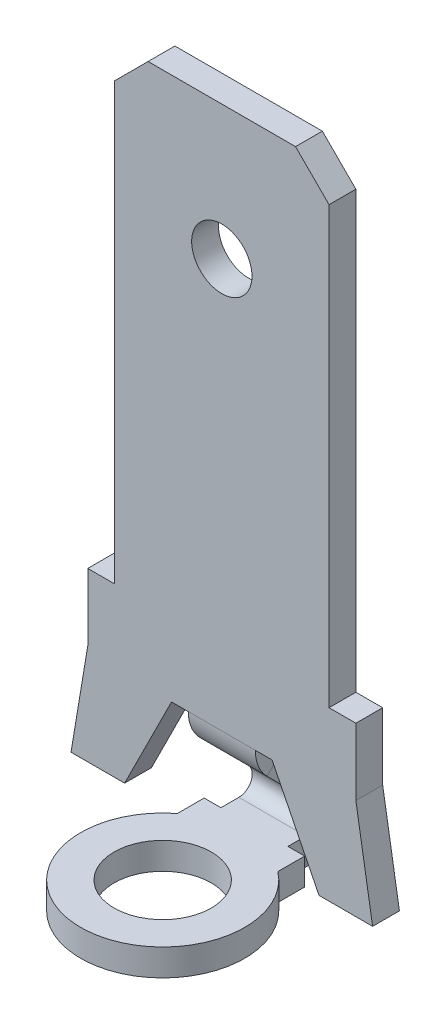
from build123d import *

# Parameters (mm, degrees)
MAINBODYS_W                           = 6.4
MAINBODYS_H                           = 0.8
MAIN_BODY_DEPTH                       = 14
BOTTOM_OF_MAIN_BODY_REACH             = 16.367
BOTTOM_OF_MAIN_BODY_DIRECTION_2_REACH = 16.367
TOPHOLES_R                            = 0.9
TOP_HOLE_DEPTH                        = 15.727185746
F_45_DEGREE_FLANGE_DEPTH              = 2
BOTTOM_FLAT_FLANGE_DEPTH              = 2
EXTENDEDBOTTOMFLANGES_W               = 3
EXTENDEDBOTTOMFLANGES_H               = 0.8
EXTENDED_BOTTOM_FLANGE_DEPTH          = 0.8
BOSSEDCYLINDERBODYS_R                 = 1.45
BOSSED_CYLINDER_BODY_DEPTH            = 0.8
C_MAIN_BODY_SIZE                      = 1


# Sheet-metal steps are written as plain solids
with BuildPart() as part:
    # MainBodyS → MAIN BODY (new body)
    with BuildSketch(Plane(origin=(0, 0, 0), x_dir=(1, 0, 0), z_dir=(0, 1, 0))):
        Rectangle(MAINBODYS_W, MAINBODYS_H)
    extrude(amount=MAIN_BODY_DEPTH)

    # BOTTOM OF MAIN BODY: up to this face of the body (flat: up to its plane)
    bottom_of_main_body_end = Plane(part.part.faces().sort_by_distance((0, 7, 0.4))[0])
    # BottomMainBodyS → BOTTOM OF MAIN BODY (add, up to the picked face)
    with BuildSketch(Plane.XY, mode=Mode.PRIVATE) as bottom_of_main_body_sk1:
        Polygon((0, 0), (4, 0), (4, -2), (4.5, -5), (2.9, -5), (1.5, -2.2), (0, -2.2), align=None)
    bottom_of_main_body_tool1 = split(extrude(bottom_of_main_body_sk1.sketch, amount=BOTTOM_OF_MAIN_BODY_REACH, mode=Mode.PRIVATE), bisect_by=bottom_of_main_body_end, keep=Keep.BOTH, mode=Mode.PRIVATE)
    bottom_of_main_body = bottom_of_main_body_tool1.solids().sort_by(Axis((2.475691, -2.049989, 0), (0, 0, 1)))[0]
    add(bottom_of_main_body)

    # BOTTOM OF MAIN BODY direction 2: up to this face of the body (flat: up to its plane)
    bottom_of_main_body_direction_2_end = Plane(part.part.faces().sort_by_distance((0, 7, -0.4))[0])
    # BottomMainBodyS → BOTTOM OF MAIN BODY direction 2 (add, up to the picked face)
    with BuildSketch(Plane.XY, mode=Mode.PRIVATE) as bottom_of_main_body_direction_2_sk1:
        Polygon((0, 0), (4, 0), (4, -2), (4.5, -5), (2.9, -5), (1.5, -2.2), (0, -2.2), align=None)
    bottom_of_main_body_direction_2_tool1 = split(extrude(bottom_of_main_body_direction_2_sk1.sketch, amount=-BOTTOM_OF_MAIN_BODY_DIRECTION_2_REACH, mode=Mode.PRIVATE), bisect_by=bottom_of_main_body_direction_2_end, keep=Keep.BOTH, mode=Mode.PRIVATE)
    bottom_of_main_body_direction_2 = bottom_of_main_body_direction_2_tool1.solids().sort_by(Axis((2.475691, -2.049989, 0), (0, 0, -1)))[0]
    add(bottom_of_main_body_direction_2)

    # BMB HM: BOTTOM OF MAIN BODY, BOTTOM OF MAIN BODY direction 2 across plane
    add(bottom_of_main_body.mirror(Plane(origin=(0, 0, 0), x_dir=(0, 0, 1), z_dir=(1, 0, 0))))
    add(bottom_of_main_body_direction_2.mirror(Plane(origin=(0, 0, 0), x_dir=(0, 0, 1), z_dir=(1, 0, 0))))

    # TopHoleS → TOP HOLE (cut, through all)
    with BuildSketch(Plane.XY.offset(0.4)):
        with Locations((0, 10)):
            Circle(TOPHOLES_R)
    extrude(amount=-TOP_HOLE_DEPTH, mode=Mode.SUBTRACT)

    # 45 DEGREE FLANGE section (across the edge) → 45 DEGREE FLANGE (add)
    with BuildSketch(Plane(origin=(1, -2.365685425, -0.4), x_dir=(0, 0.7071067811865438, -0.7071067811865512), z_dir=(-1, 0, 0))):
        with BuildLine():
            Line((-0.8, 0.165685425), (-0.8, 2.2))
            Line((-0.8, 2.2), (0, 2.2))
            Line((0, 2.2), (0, 0.165685425))
            ThreePointArc((0, 0.165685425), (0.030448187, 0.012612052), (0.117157288, -0.117157288))
            Line((0.117157288, -0.117157288), (-0.448528137, -0.682842712))
            ThreePointArc((-0.448528137, -0.682842712), (-0.708655439, -0.293534694), (-0.8, 0.165685425))
        make_face()
    extrude(amount=F_45_DEGREE_FLANGE_DEPTH)

    # BOTTOM FLAT FLANGE section (across the edge) → BOTTOM FLAT FLANGE (add)
    with BuildSketch(Plane(origin=(-1, -5.169848481, -2.072792206), x_dir=(0, 1, 0), z_dir=(1, 0, 0))):
        with BuildLine():
            Line((-0.8, 0.965685425), (-0.8, 1.5))
            Line((-0.8, 1.5), (0, 1.5))
            Line((0, 1.5), (0, 0.965685425))
            ThreePointArc((0, 0.965685425), (0.246926627, 0.596133612), (0.682842712, 0.682842712))
            Line((0.682842712, 0.682842712), (1.248528137, 0.117157288))
            ThreePointArc((1.248528137, 0.117157288), (-0.059220119, -0.142970014), (-0.8, 0.965685425))
        make_face()
    extrude(amount=BOTTOM_FLAT_FLANGE_DEPTH)

    # ExtendedBottomFlangeS → EXTENDED BOTTOM FLANGE (add)
    with BuildSketch(Plane.XY.offset(-0.572792206)):
        with Locations((0, -5.569848481)):
            Rectangle(EXTENDEDBOTTOMFLANGES_W, EXTENDEDBOTTOMFLANGES_H)
    extrude(amount=EXTENDED_BOTTOM_FLANGE_DEPTH)

    # BossedCylinderBodyS → BOSSED  CYLINDER BODY (add)
    with BuildSketch(Plane.XZ.offset(5.969848481)):
        with BuildLine():
            Line((-1.5, 0.227207794), (1.5, 0.227207794))
            ThreePointArc((1.5, 0.227207794), (0, 4.614344857), (-1.5, 0.227207794))
        make_face()
        with Locations(Location((0, 2.164344857, 0), (0, 0, 270))):
            Circle(BOSSEDCYLINDERBODYS_R, mode=Mode.SUBTRACT)
    extrude(amount=-BOSSED_CYLINDER_BODY_DEPTH)

    # C MAIN BODY
    c_main_body_edges = [part.edges().sort_by_distance(p)[0] for p in [
        (-3.2, 14, 0),
        (3.2, 14, 0),
    ]]
    chamfer(c_main_body_edges, length=C_MAIN_BODY_SIZE)


solid = part.part
